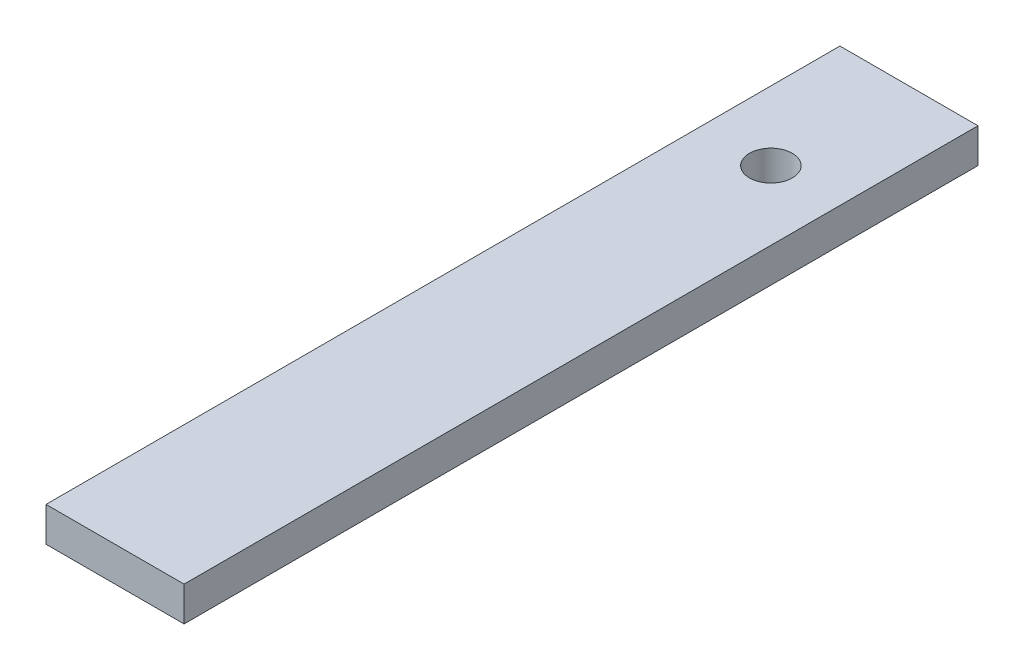
from build123d import *

# Parameters (mm, degrees)
SKETCH1_W           = 50.8
SKETCH1_H           = 292.1
SKETCH1_R           = 7.874
BOSS_EXTRUDE1_DEPTH = 12.7


with BuildPart() as part:
    # Sketch1 → Boss-Extrude1 (new body)
    with BuildSketch(Plane(origin=(0, 0, 0), x_dir=(1, 0, 0), z_dir=(0, 1, 0))):
        with Locations((25.4, 146.05)):
            Rectangle(SKETCH1_W, SKETCH1_H)
        with Locations((25.4, 241.3)):
            Circle(SKETCH1_R, mode=Mode.SUBTRACT)
    extrude(amount=BOSS_EXTRUDE1_DEPTH)


solid = part.part
